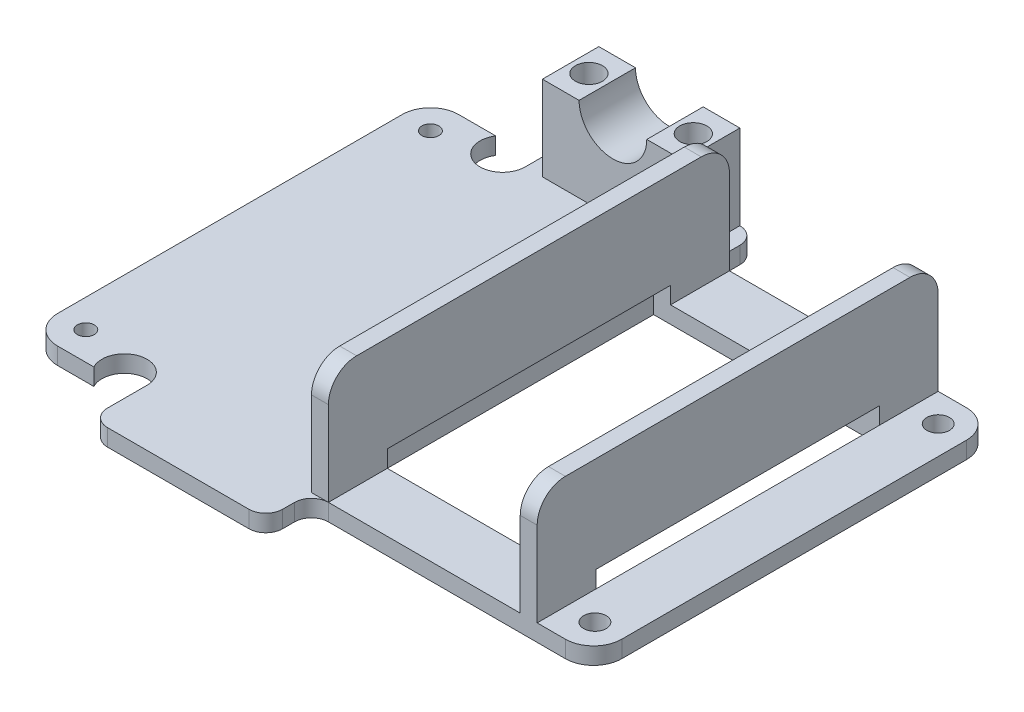
from build123d import *

# Parameters (mm, degrees)
BOSS_EXTRUDE1_DEPTH = 3
SKETCH2_R           = 1.4999999999999973
SKETCH2_R_2         = 1.9999999999999967
CUT_EXTRUDE1_DEPTH  = 10
SKETCH4_R           = 1.999999999734694
CUT_EXTRUDE2_DEPTH  = 10
BOSS_EXTRUDE2_DEPTH = 20
CUT_EXTRUDE3_START  = -10
SKETCH6_W           = 50.2
SKETCH6_H           = 6
CUT_EXTRUDE3_DEPTH  = 40
CUT_EXTRUDE5_DEPTH  = 19.999999999999996
FILLET1_R           = 5
FILLET2_R           = 5
BOSS_EXTRUDE6_DEPTH = 15
SKETCH14_R          = 5.999999999999999
CUT_EXTRUDE7_DEPTH  = 15
SKETCH16_R          = 2.4
SKETCH16_R_2        = 2.400000000000001
CUT_EXTRUDE8_DEPTH  = 10
BOSS_EXTRUDE7_DEPTH = 10
BOSS_EXTRUDE8_DEPTH = 10
LPATTERN1_COUNT     = 2
LPATTERN1_PITCH     = 10
CUT_EXTRUDE9_DEPTH  = 10
FILLET3_R           = 3


with BuildPart() as part:
    # Sketch1 → Boss-Extrude1 (new body)
    with BuildSketch(Plane(origin=(0, 0, 0), x_dir=(1, 0, 0), z_dir=(0, 1, 0))):
        Polygon((49.999999999999986, 35.54), (-50, 35.53999999999999), (-50, -35.54), (49.999999999999986, -35.54), align=None)
    extrude(amount=BOSS_EXTRUDE1_DEPTH)

    # Sketch2 → Cut-Extrude1 (cut)
    with BuildSketch(Plane(origin=(0, 3, 0), x_dir=(1, 0, 0), z_dir=(0, 1, 0))):
        with Locations((-45.00000000000001, 30.539999999999996)):
            Circle(SKETCH2_R)
        with Locations((-45.00000000000001, -30.540000000000003)):
            Circle(SKETCH2_R)
        with Locations((44.99999999999999, 30.539999999999996)):
            Circle(SKETCH2_R_2)
    extrude(amount=-CUT_EXTRUDE1_DEPTH, mode=Mode.SUBTRACT)

    # Sketch4 → Cut-Extrude2 (cut)
    with BuildSketch(Plane(origin=(0, 3, 0), x_dir=(1, 0, 0), z_dir=(0, 1, 0))):
        with Locations((45.000000000191015, -30.304347370038403)):
            Circle(SKETCH4_R)
    extrude(amount=-CUT_EXTRUDE2_DEPTH, mode=Mode.SUBTRACT)

    # Sketch5 → Boss-Extrude2 (add)
    with BuildSketch(Plane(origin=(0, 3, 0), x_dir=(1, 0, 0), z_dir=(0, 1, 0))):
        Polygon((39.999999999999986, 35.53999999999999), (40.00000000000001, -35.54), (37.00000000000001, -35.54), (36.999999999999986, 35.53999999999999), align=None)
        Polygon((-1.128e-14, 35.54), (-2.82e-15, -35.54), (2.9999999999999907, -35.54), (2.999999999999989, 35.53999999999999), align=None)
    extrude(amount=BOSS_EXTRUDE2_DEPTH)

    # Sketch6 → Cut-Extrude3 (cut)
    with BuildSketch(Plane(origin=(49.999999999999986, 0, 0), x_dir=(-1e-16, 0, -1), z_dir=(1, 0, -1e-16)).offset(CUT_EXTRUDE3_START)):
        with Locations((0, 3.0000000000000018)):
            Rectangle(SKETCH6_W, SKETCH6_H)
    extrude(amount=-CUT_EXTRUDE3_DEPTH, mode=Mode.SUBTRACT)

    # Sketch10 → Cut-Extrude5 (cut)
    with BuildSketch(Plane(origin=(0, 3, 0), x_dir=(1, 0, 0), z_dir=(0, 1, 0))):
        with BuildLine():
            Line((-31.05394252513386, 33.38851452574947), (-1.128e-14, 33.38851452574947))
            Line((-1.128e-14, 33.38851452574947), (-1.128e-14, 35.54))
            Line((-1.128e-14, 35.54), (-31.681834837931536, 35.53999999999999))
            ThreePointArc((-31.681834837931536, 35.53999999999999), (-38.893762231110244, 32.26789655980597), (-31.05394252513386, 33.38851452574947))
        make_face()
        with BuildLine():
            Line((-31.053952866848274, -33.640959258065664), (-1.388e-14, -33.640959258065664))
            Line((-1.388e-14, -33.640959258065664), (-2.82e-15, -35.54))
            Line((-2.82e-15, -35.54), (-31.533492064556413, -35.54))
            ThreePointArc((-31.533492064556413, -35.54), (-38.93221557127969, -32.66163377824995), (-31.053952866848274, -33.640959258065664))
        make_face()
    extrude(amount=-CUT_EXTRUDE5_DEPTH, mode=Mode.SUBTRACT)

    # Fillet1
    fillet1_edges = [part.edges().sort_by_distance(p)[0] for p in [
        (49.999999999999986, 1.5, 35.54),
        (49.999999999999986, 1.5, -35.54),
        (-50, 1.5, -35.53999999999999),
        (-50, 1.5, 35.54),
    ]]
    fillet(fillet1_edges, radius=FILLET1_R)

    # Fillet2
    fillet2_edges = [part.edges().sort_by_distance(p)[0] for p in [
        (1.499999999999989, 23, -35.53999999999999),
        (38.499999999999986, 23, -35.53999999999999),
        (38.50000000000001, 23, 35.54),
        (1.4999999999999938, 23, 35.54),
    ]]
    fillet(fillet2_edges, radius=FILLET2_R)

    # Sketch13 → Boss-Extrude6 (add)
    with BuildSketch(Plane(origin=(0, 3, 0), x_dir=(1, 0, 0), z_dir=(0, 1, 0))):
        Polygon((-3.0000000000000027, 33.38851452574947), (-28.000000000000004, 33.38851452574947), (-28.000000000000004, 23.38851452574947), (-3.0000000000000027, 23.388514525749475), align=None)
    boss_extrude6 = extrude(amount=BOSS_EXTRUDE6_DEPTH)

    # Sketch14 → Cut-Extrude7 (cut)
    with BuildSketch(Plane(origin=(0, 0, -33.38851452574947), x_dir=(-1, 0, 0), z_dir=(0, 0, -1))):
        with Locations((15.500000000000004, 18)):
            Circle(SKETCH14_R)
    cut_extrude7 = extrude(amount=-CUT_EXTRUDE7_DEPTH, mode=Mode.SUBTRACT)

    # Sketch16 → Cut-Extrude8 (cut)
    with BuildSketch(Plane(origin=(0, 18, 0), x_dir=(1, 0, 0), z_dir=(0, 1, 0))):
        with Locations((-6.250000000000003, 28.388514525749475)):
            Circle(SKETCH16_R)
        with Locations((-24.75, 28.38851452574947)):
            Circle(SKETCH16_R_2)
    cut_extrude8 = extrude(amount=-CUT_EXTRUDE8_DEPTH, mode=Mode.SUBTRACT)

    # Sketch17 → Boss-Extrude7 (add)
    with BuildSketch(Plane.XY.offset(33.640959258065664)):
        Polygon((-31.053952866848274, 3), (0, 3), (-2.82e-15, 0), (-31.053952866848274, 0), align=None)
    extrude(amount=BOSS_EXTRUDE7_DEPTH)

    # Sketch18 → Boss-Extrude8 (add)
    with BuildSketch(Plane(origin=(0, 0, -33.38851452574947), x_dir=(-1, 0, 0), z_dir=(0, 0, -1))):
        Polygon((1.102e-14, 3), (31.05394252513386, 3), (31.05394252513386, 0), (1.3e-15, 0), align=None)
    extrude(amount=BOSS_EXTRUDE8_DEPTH)

    # LPattern1: Boss-Extrude6, Cut-Extrude7, Cut-Extrude8 ×2
    with Locations(*[(0, 0, -i * LPATTERN1_PITCH) for i in range(1, LPATTERN1_COUNT)]):
        add(boss_extrude6)
        add(cut_extrude7, mode=Mode.SUBTRACT)
        add(cut_extrude8, mode=Mode.SUBTRACT)

    # Sketch19 → Cut-Extrude9 (cut)
    with BuildSketch(Plane.XY.offset(-23.388514525749475)):
        Polygon((-28, 18), (-3.0000000000000027, 18), (-2.9999999999999996, 3), (-27.999999999999996, 3), align=None)
    extrude(amount=-CUT_EXTRUDE9_DEPTH, mode=Mode.SUBTRACT)

    # Fillet3
    fillet3_edges = [part.edges().sort_by_distance(p)[0] for p in [
        (-1.5e-15, 1.5, 35.54),
        (-1.41e-15, 1.5, 43.640959258065664),
        (-31.053952866848274, 1.5, 43.640959258065664),
        (-31.05394252513386, 1.5, -43.38851452574947),
        (-6.16e-15, 1.5, -43.38851452574947),
    ]]
    fillet(fillet3_edges, radius=FILLET3_R)


solid = part.part
